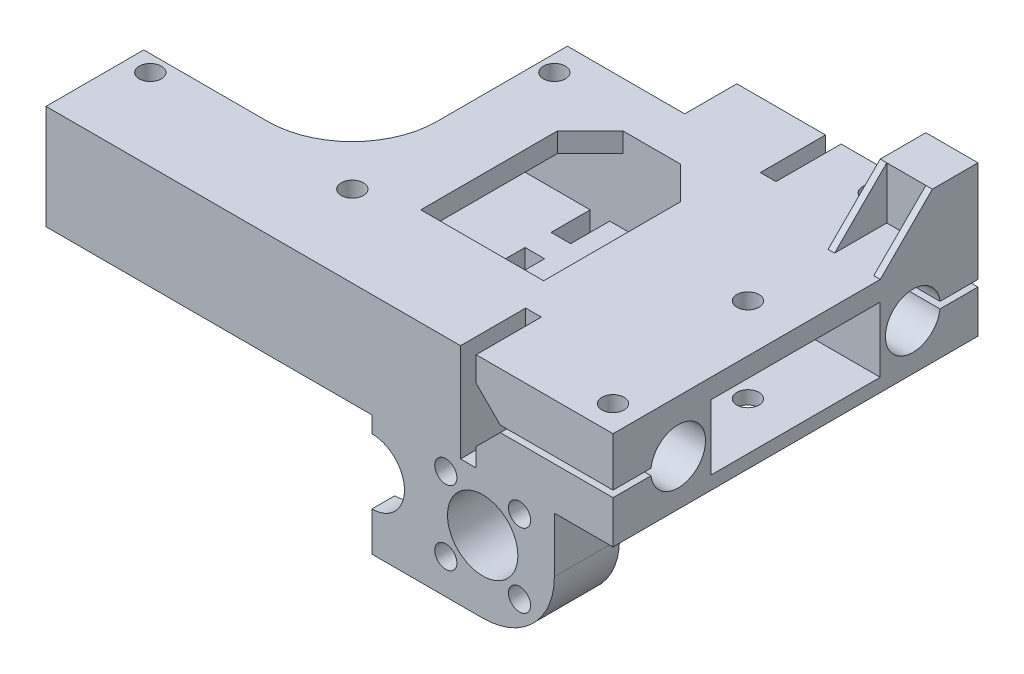
from build123d import *

# Parameters (mm, degrees)
SKETCH_1_R           = 1.7
SKETCH_1_R_2         = 5.4
EXTRUDE_1_DEPTH      = 10
EXTRUDE_START        = -10
EXTRUDE_2_DEPTH      = 10
CUT_EXTRUDE_1_DEPTH  = 2
EXTRUDE_START_2      = -46
EXTRUDE_3_DEPTH      = 36
EXTRUDE_START_3      = 6.5
EXTRUDE_4_DEPTH      = 3.5
EXTRUDE_5_DEPTH      = 4
SKETCH_1_10_W        = 8
SKETCH_1_10_H        = 8
SKETCH_1_10_R        = 1.5
EXTRUDE_6_DEPTH      = 7
RIB_2_REACH          = 105.331
SKETCH_4_WALL_W      = 219.975267576
SKETCH_4_WALL_H      = 1
RIB_START            = -1
RIB_3_DEPTH          = 1
EXTRUDE_START_4      = -0.4
SKETCH_6_R           = 1.5
EXTRUDE_7_DEPTH      = 0.4
SKETCH_7_R           = 1.7
SKETCH_7_R_2         = 1.35
CUT_EXTRUDE_2_DEPTH  = 89.290712988
SKETCH_8_W           = 26
SKETCH_8_H           = 10
CUT_EXTRUDE_3_DEPTH  = 105.174133066
CUT_EXTRUDE_4_DEPTH  = 22
CUT_EXTRUDE_5_DEPTH  = 24
SKETCH_7_4_W         = 2.4
SKETCH_7_4_H         = 10
CUT_EXTRUDE_9_DEPTH  = 15.05
CHAMFER_1_SIZE       = 3.7
CUT_EXTRUDE_START    = -17.562916
SKETCH_7_5_W         = 3
SKETCH_7_5_H         = 6
CUT_EXTRUDE_10_DEPTH = 17.562916
CUT_EXTRUDE_11_REACH = 90.291
CHAMFER_2_SIZE       = 5
CHAMFER_3_SIZE       = 2
CHAMFER_3_SIZE2      = 2.5
SKETCH_9_W           = 11.322924712
SKETCH_9_H           = 24.282583949
CUT_EXTRUDE_12_DEPTH = 93.82914413


# Read off the part's stored shape, not the designer's step: 筋3
with BuildPart() as part:
    # 草图1 → 凸台-拉伸1 (new body)
    with BuildSketch(Plane.XY):
        with BuildLine():
            Line((-17, -7.5), (-17, -11))
            Line((-17, -11), (0, -11))
            ThreePointArc((0, -11), (7.778174593, -7.778174593), (11, 0))
            Line((11, 0), (11, 8.456854249))
            Line((11, 8.456854249), (28, 8.456854249))
            Line((28, 8.456854249), (28, 10.5))
            Line((28, 10.5), (21, 10.5))
            Line((21, 10.5), (21, 20.5))
            Line((21, 20.5), (28, 20.5))
            Line((28, 20.5), (28, 23.5))
            Line((28, 23.5), (-67, 23.5))
            Line((-67, 23.5), (-67, 7.5))
            Line((-67, 7.5), (-17, 7.5))
            ThreePointArc((-17, 7.5), (-9.5, 0), (-17, -7.5))
        make_face()
        with Locations((-5.656854249, -5.656854249)):
            Circle(SKETCH_1_R, mode=Mode.SUBTRACT)
        with Locations((5.656854249, -5.656854249)):
            Circle(SKETCH_1_R, mode=Mode.SUBTRACT)
        Circle(SKETCH_1_R_2, mode=Mode.SUBTRACT)
        with Locations((-5.656854249, 5.656854249)):
            Circle(SKETCH_1_R, mode=Mode.SUBTRACT)
        with Locations((5.656854249, 5.656854249)):
            Circle(SKETCH_1_R, mode=Mode.SUBTRACT)
    extrude(amount=EXTRUDE_1_DEPTH)

    # 草图1<6> → 凸台-拉伸2 (add)
    with BuildSketch(Plane.XY.offset(EXTRUDE_START)):
        with BuildLine():
            Line((21, 10.5), (21, 20.5))
            Line((21, 20.5), (28, 20.5))
            Line((28, 20.5), (28, 23.5))
            Line((28, 23.5), (-67, 23.5))
            Line((-67, 23.5), (-67, 7.5))
            Line((-67, 7.5), (-17, 7.5))
            ThreePointArc((-17, 7.5), (-9.5, 0), (-17, -7.5))
            Line((-17, -7.5), (-17, -11))
            ThreePointArc((-17, -11), (-8.462447466, -5.036106671), (-8.643737412, 5.376624039))
            ThreePointArc((-8.643737412, 5.376624039), (-7.46899014, 8.047704206), (-4.579821288, 8.456854249))
            Line((-4.579821288, 8.456854249), (28, 8.456854249))
            Line((28, 8.456854249), (28, 10.5))
            Line((28, 10.5), (21, 10.5))
        make_face()
    extrude(amount=EXTRUDE_2_DEPTH)

    # 草图3 → 切除-拉伸1 (cut)
    with BuildSketch(Plane(origin=(0, 0, 0), x_dir=(-1, 0, 0), z_dir=(0, 0, -1))):
        Polygon((7.919595949, 3.39411255), (8.747816894, 6.485075194), (6.485075194, 8.747816894), (3.39411255, 7.919595949), (2.565891605, 4.828633305), (4.828633305, 2.565891605), align=None)
        Polygon((-2.565891605, 4.828633305), (-3.39411255, 7.919595949), (-6.485075194, 8.747816894), (-8.747816894, 6.485075194), (-7.919595949, 3.39411255), (-4.828633305, 2.565891605), align=None)
        Polygon((-3.39411255, -7.919595949), (-2.565891605, -4.828633305), (-4.828633305, -2.565891605), (-7.919595949, -3.39411255), (-8.747816894, -6.485075194), (-6.485075194, -8.747816894), align=None)
        Polygon((2.565891605, -4.828633305), (3.39411255, -7.919595949), (6.485075194, -8.747816894), (8.747816894, -6.485075194), (7.919595949, -3.39411255), (4.828633305, -2.565891605), align=None)
    extrude(amount=-CUT_EXTRUDE_1_DEPTH, mode=Mode.SUBTRACT)

    # 草图1<7> → 凸台-拉伸3 (add)
    with BuildSketch(Plane.XY.offset(EXTRUDE_START_2)):
        with BuildLine():
            Line((21, 8.456854249), (21, 23.5))
            Line((21, 23.5), (-67, 23.5))
            Line((-67, 23.5), (-67, 7.5))
            Line((-67, 7.5), (-17, 7.5))
            ThreePointArc((-17, 7.5), (-9.5, 0), (-17, -7.5))
            Line((-17, -7.5), (-17, -11))
            ThreePointArc((-17, -11), (-8.462447466, -5.036106671), (-8.643737412, 5.376624039))
            ThreePointArc((-8.643737412, 5.376624039), (-7.46899014, 8.047704206), (-4.579821288, 8.456854249))
            Line((-4.579821288, 8.456854249), (21, 8.456854249))
        make_face()
    extrude(amount=EXTRUDE_3_DEPTH)

    # 草图1<8> → 凸台-拉伸4 (add)
    with BuildSketch(Plane.XY.offset(EXTRUDE_START_3)):
        with BuildLine():
            Line((-17, -5), (-17, -7.5))
            ThreePointArc((-17, -7.5), (-9.5, 0), (-17, 7.5))
            Line((-17, 7.5), (-17, 5))
            ThreePointArc((-17, 5), (-12, 0), (-17, -5))
        make_face()
    extrude(amount=EXTRUDE_4_DEPTH)

    # 草图1<9> → 凸台-拉伸5 (add)
    with BuildSketch(Plane.XY.offset(EXTRUDE_START_2)):
        with BuildLine():
            Line((-17, -5), (-17, -7.5))
            ThreePointArc((-17, -7.5), (-9.5, 0), (-17, 7.5))
            Line((-17, 7.5), (-17, 5))
            ThreePointArc((-17, 5), (-12, 0), (-17, -5))
        make_face()
    extrude(amount=EXTRUDE_5_DEPTH)

    # 草图1<10> → 凸台-拉伸6 (add)
    with BuildSketch(Plane.XY.offset(EXTRUDE_START_2)):
        with Locations((16, 27.5)):
            Rectangle(SKETCH_1_10_W, SKETCH_1_10_H)
        with Locations((16, 27.5)):
            Circle(SKETCH_1_10_R, mode=Mode.SUBTRACT)
    extrude(amount=EXTRUDE_6_DEPTH)

    # 草图4 wall → 筋2 (add, up to next)
    with BuildSketch(Plane(origin=(20, 27.5, -35), x_dir=(0, -0.707106781187, 0.707106781187), z_dir=(0, -0.707106781187, -0.707106781187)), mode=Mode.PRIVATE) as rib_2_sk1:
        with Locations((0, 0.5)):
            Rectangle(SKETCH_4_WALL_W, SKETCH_4_WALL_H)
    rib_2_tool1 = extrude(rib_2_sk1.sketch, amount=RIB_2_REACH, mode=Mode.PRIVATE) - part.part
    add(rib_2_tool1.solids().sort_by_distance((20, 27.5, -35))[0])

    # 筋3 outline → 筋3 (add)
    with BuildSketch(Plane.ZY.offset(-12).offset(RIB_START)):
        Polygon((-31, 23.5), (-39, 31.5), (-39, 23.5), align=None)
    extrude(amount=RIB_3_DEPTH)

    # 草图6 → 凸台-拉伸7 (add)
    with BuildSketch(Plane.XY.offset(-39).offset(EXTRUDE_START_4)):
        with Locations((16, 27.5)):
            Circle(SKETCH_6_R)
    extrude(amount=EXTRUDE_7_DEPTH)

    # 草图7 → 切除-拉伸2 (cut, through all)
    with BuildSketch(Plane(origin=(0, 23.5, 0), x_dir=(1, 0, 0), z_dir=(0, 1, 0))):
        with BuildLine():
            Line((-17, 38), (-17, 46))
            Line((-17, 46), (-69, 46))
            Line((-69, 46), (-69, 5))
            Line((-69, 5), (-48, 5))
            ThreePointArc((-48, 5), (-38.807611845, 8.807611845), (-35, 18))
            Line((-35, 18), (-35, 38))
            Line((-35, 38), (-17, 38))
        make_face()
        with Locations(Location((12.7, 18, 0), (0, 0, 180))):
            Circle(SKETCH_7_R)
        with Locations(Location((16, -6, 0), (0, 0, 180))):
            Circle(SKETCH_7_R)
        with Locations(Location((8, 42, 0), (0, 0, 180))):
            Circle(SKETCH_7_R)
        with Locations(Location((-32.5, 2.5, 0), (0, 0, 180))):
            Circle(SKETCH_7_R)
        with Locations(Location((-63.5, 2.5, 0), (0, 0, 180))):
            Circle(SKETCH_7_R)
        with Locations(Location((-32.5, 33.5, 0), (0, 0, 180))):
            Circle(SKETCH_7_R)
        with Locations(Location((24.5, -5, 0), (0, 0, 180))):
            Circle(SKETCH_7_R_2)
        with Locations(Location((24.5, 5, 0), (0, 0, 270))):
            Circle(SKETCH_7_R_2)
    extrude(amount=-CUT_EXTRUDE_2_DEPTH, mode=Mode.SUBTRACT)

    # 草图8 → 切除-拉伸3 (cut, through all)
    with BuildSketch(Plane(origin=(21, 0, 0), x_dir=(0, 0, -1), z_dir=(1, 0, 0))):
        with Locations((18, 15.5)):
            Rectangle(SKETCH_8_W, SKETCH_8_H)
    extrude(amount=-CUT_EXTRUDE_3_DEPTH, mode=Mode.SUBTRACT)

    # 草图8<3> → 切除-拉伸4 (cut)
    with BuildSketch(Plane(origin=(21, 0, 0), x_dir=(0, 0, -1), z_dir=(1, 0, 0))):
        with BuildLine():
            ThreePointArc((36, 19.7), (31.8, 15.5), (36, 11.3))
            Line((36, 11.3), (36, 19.7))
        make_face()
        with BuildLine():
            ThreePointArc((4.2, 15.5), (2.969848481, 18.469848481), (0, 19.7))
            Line((0, 19.7), (0, 11.3))
            ThreePointArc((0, 11.3), (2.969848481, 12.530151519), (4.2, 15.5))
        make_face()
    extrude(amount=-CUT_EXTRUDE_4_DEPTH, mode=Mode.SUBTRACT)

    # 草图8<4> → 切除-拉伸5 (cut)
    with BuildSketch(Plane(origin=(21, 0, 0), x_dir=(0, 0, -1), z_dir=(1, 0, 0))):
        with BuildLine():
            Line((0, 11.3), (0, 19.7))
            ThreePointArc((0, 19.7), (-2.787471973, 18.641655614), (-4.170131892, 16))
            Line((-4.170131892, 16), (-10, 16))
            Line((-10, 16), (-10, 15))
            Line((-10, 15), (-4.170131892, 15))
            ThreePointArc((-4.170131892, 15), (-2.787471973, 12.358344386), (0, 11.3))
        make_face()
        with BuildLine():
            Line((40.170131892, 15), (46, 15))
            Line((46, 15), (46, 16))
            Line((46, 16), (40.170131892, 16))
            ThreePointArc((40.170131892, 16), (38.787471973, 18.641655614), (36, 19.7))
            Line((36, 19.7), (36, 11.3))
            ThreePointArc((36, 11.3), (38.787471973, 12.358344386), (40.170131892, 15))
        make_face()
    extrude(amount=-CUT_EXTRUDE_5_DEPTH, mode=Mode.SUBTRACT)

    # 草图7<4> → 切除-拉伸9 (cut)
    with BuildSketch(Plane(origin=(0, 23.5, 0), x_dir=(1, 0, 0), z_dir=(0, 1, 0))):
        with Locations((-2.2, -5)):
            Rectangle(SKETCH_7_4_W, SKETCH_7_4_H)
        with Locations((-2.2, 41)):
            Rectangle(SKETCH_7_4_W, SKETCH_7_4_H)
    extrude(amount=-CUT_EXTRUDE_9_DEPTH, mode=Mode.SUBTRACT)

    # 倒角1
    chamfer_1_edges = [part.edges().sort_by_distance(p)[0] for p in [
        (-1, 16, -43.085065946),
        (-1, 15, -43.085065946),
        (-1, 16, 7.085065946),
        (-1, 15, 7.085065946),
    ]]
    chamfer(chamfer_1_edges, length=CHAMFER_1_SIZE)

    # 草图7<5> → 切除-拉伸10 (cut)
    with BuildSketch(Plane(origin=(0, 23.5, 0), x_dir=(1, 0, 0), z_dir=(0, 1, 0)).offset(CUT_EXTRUDE_START)):
        with Locations((-7.143737412, 18)):
            Rectangle(SKETCH_7_5_W, SKETCH_7_5_H)
        with Locations((-7.143737412, 28)):
            Rectangle(SKETCH_7_5_W, SKETCH_7_5_H)
        with Locations((-23, 28)):
            Rectangle(SKETCH_7_5_W, SKETCH_7_5_H)
        with Locations((-23, 18)):
            Rectangle(SKETCH_7_5_W, SKETCH_7_5_H)
        with Locations((-23, 8)):
            Rectangle(SKETCH_7_5_W, SKETCH_7_5_H)
        with Locations((-7.143737412, 8)):
            Rectangle(SKETCH_7_5_W, SKETCH_7_5_H)
    extrude(amount=CUT_EXTRUDE_10_DEPTH, mode=Mode.SUBTRACT)

    # 草图7<6> → 切除-拉伸11 (cut, up to next)
    with BuildSketch(Plane(origin=(0, 23.5, 0), x_dir=(1, 0, 0), z_dir=(0, 1, 0)), mode=Mode.PRIVATE) as cut_extrude_11_sk1:
        Polygon((-21.5, 5), (-8.643737412, 5), (-8.643737412, 11), (-5.643737412, 11), (-5.643737412, 15), (-8.643737412, 15), (-8.643737412, 21), (-5.643737412, 21), (-5.643737412, 25), (-8.643737412, 25), (-8.643737412, 31), (-21.5, 31), (-21.5, 25), (-24.5, 25), (-24.5, 21), (-21.5, 21), (-21.5, 15), (-24.5, 15), (-24.5, 11), (-21.5, 11), align=None)
    cut_extrude_11_tool1 = extrude(cut_extrude_11_sk1.sketch, amount=-CUT_EXTRUDE_11_REACH, mode=Mode.PRIVATE) & part.part
    add(cut_extrude_11_tool1.solids().sort_by_distance((-15.071869, 23.5, -18))[0], mode=Mode.SUBTRACT)

    # 倒角2
    chamfer_2_edges = [part.edges().sort_by_distance(p)[0] for p in [
        (-5.643737412, 22, -31),
        (-24.5, 22, -31),
    ]]
    chamfer(chamfer_2_edges, length=CHAMFER_2_SIZE)

    # 倒角3
    chamfer_3_edges = [part.edges().sort_by_distance(p)[0] for p in [
        (-12, 0, -42),
    ]]
    chamfer_3_side = [part.faces().sort_by_distance(p)[0] for p in [
        (-9.667705098, 0, -42),
    ]]
    chamfer(chamfer_3_edges, length=CHAMFER_3_SIZE, length2=CHAMFER_3_SIZE2, reference=chamfer_3_side[0])

    # 草图9 → 切除-拉伸12 (cut, through all)
    with BuildSketch(Plane.XY.offset(10)):
        with Locations((25.661462356, 19.358708026)):
            Rectangle(SKETCH_9_W, SKETCH_9_H)
    extrude(amount=-CUT_EXTRUDE_12_DEPTH, mode=Mode.SUBTRACT)


solid = part.part
